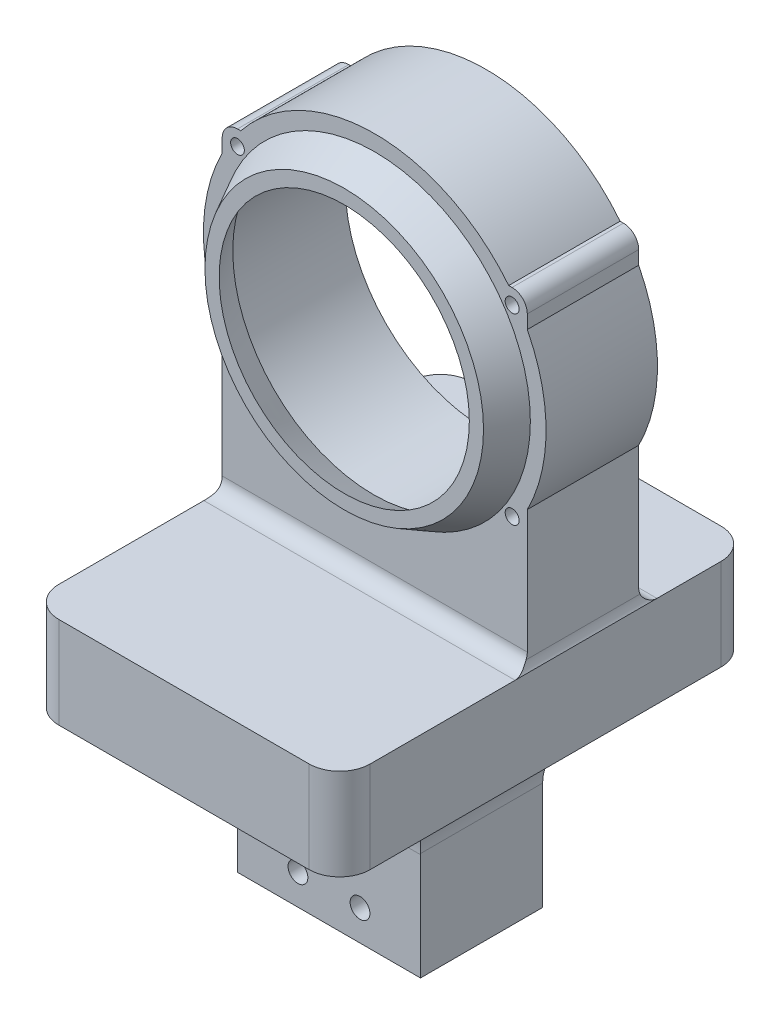
from build123d import *
from OCP.BRepAlgoAPI import BRepAlgoAPI_Cut
from OCP.TopTools import TopTools_ListOfShape

# Parameters (mm, degrees)
CROQUIS1_W              = 102
CROQUIS1_H              = 135
SALIENTE_EXTRUIR1_DEPTH = 30
SALIENTE_EXTRUIR2_START = 5
CROQUIS3_R              = 46.15
SALIENTE_EXTRUIR2_DEPTH = 36.5
CROQUIS5_R              = 51
CROQUIS5_R_2            = 41
SALIENTE_EXTRUIR3_DEPTH = 10
CHAFL_N1_SIZE           = 5.350722602
CHAFL_N1_SIZE_2         = 10
CHAFL_N2_SIZE2          = 5.350722602
CHAFL_N2_SIZE           = 10
REDONDEO1_R             = 5
CROQUIS7_R              = 2.248271999
CROQUIS7_R_2            = 2.283107554
CORTAR_EXTRUIR2_DEPTH   = 195.035937393
REDONDEO2_R             = 10
CROQUIS8_W              = 60
CROQUIS8_H              = 40
CROQUIS8_W_2            = 40
CROQUIS8_H_2            = 20
SALIENTE_EXTRUIR4_DEPTH = 60
REDONDEO3_START         = -20
REDONDEO3_DEPTH         = 40
REDONDEO3_START_2       = -51.000005347
REDONDEO3_2_DEPTH       = 102.000005347
REDONDEO3_START_3       = -57.5
REDONDEO3_3_DEPTH       = 115
CROQUIS9_R              = 3.25
CORTAR_EXTRUIR3_DEPTH   = 189.428222408


with BuildPart() as part:
    # Croquis1 → Saliente-Extruir1 (new body)
    with BuildSketch(Plane(origin=(0, 0, 0), x_dir=(1, 0, 0), z_dir=(0, 1, 0))):
        Rectangle(CROQUIS1_W, CROQUIS1_H)
    extrude(amount=SALIENTE_EXTRUIR1_DEPTH)

    # Croquis3 → Saliente-Extruir2 (add)
    with BuildSketch(Plane.XY.offset(SALIENTE_EXTRUIR2_START)):
        with BuildLine():
            Line((45, 136), (43.906975528, 136))
            ThreePointArc((43.906975528, 136), (0, 157.15), (-43.906975528, 136))
            Line((-43.906975528, 136), (-45, 136))
            ThreePointArc((-45, 136), (-48.535533906, 134.535533906), (-50, 131))
            Line((-50, 131), (-50, 126.550391386))
            ThreePointArc((-50, 126.550391386), (-56.15, 101), (-50, 75.449608614))
            Line((-50, 75.449608614), (-50, 30))
            Line((-50, 30), (50, 30))
            Line((50, 30), (50, 75.449608614))
            ThreePointArc((50, 75.449608614), (56.15, 101), (50, 126.550391386))
            Line((50, 126.550391386), (50, 131))
            ThreePointArc((50, 131), (48.535533906, 134.535533906), (45, 136))
        make_face()
        with Locations((0, 101)):
            Circle(CROQUIS3_R, mode=Mode.SUBTRACT)
    extrude(amount=-SALIENTE_EXTRUIR2_DEPTH)

    # Croquis5 → Saliente-Extruir3 (add)
    with BuildSketch(Plane.XY.offset(5)):
        with Locations((0, 101)):
            Circle(CROQUIS5_R)
        with Locations((0, 101)):
            Circle(CROQUIS5_R_2, mode=Mode.SUBTRACT)
    extrude(amount=SALIENTE_EXTRUIR3_DEPTH)

    # Chaflán1
    # the kernel refuses this chamfer: 10, 5.350722602 mm, written as the material it takes off along each edge
    with BuildSketch(Plane(origin=(0, 101, 5), x_dir=(1, 0, 0), z_dir=(0, -1, 0))) as chafl_n1_piece_1_section:
        Polygon((41 + CHAFL_N1_SIZE, 0), (41, CHAFL_N1_SIZE_2), (41, 0), align=None)
    chafl_n1_piece_1 = revolve(axis=Axis((0, 101, 5), (0, 0, 1)), mode=Mode.PRIVATE)
    chafl_n1_piece_1 = chafl_n1_piece_1 & Plane(origin=(0, 101, 5), x_dir=(1, 0, 0), z_dir=(0, 0, 1)) * Cylinder(46.15, 186, mode=Mode.PRIVATE)
    add(chafl_n1_piece_1, mode=Mode.SUBTRACT)

    # Chaflán2
    chafl_n2_edges = [part.edges().sort_by_distance(p)[0] for p in [
        (-51, 101, 15),
    ]]
    chafl_n2_side = [part.faces().sort_by_distance(p)[0] for p in [
        (-51, 101, 14.892985548),
    ]]
    chamfer(chafl_n2_edges, length=CHAFL_N2_SIZE - 0.0001, length2=CHAFL_N2_SIZE2 - 0.0001, reference=chafl_n2_side[0])  # a hair under: the kernel refuses the full size

    # Redondeo1
    # the kernel refuses this fillet: 5 mm, written as the material it adds along each edge
    with BuildSketch(Plane(origin=(-50, 30, -31.5), x_dir=(0, 0, -1), z_dir=(1, 0, 0)), Plane(origin=(-50, 30, 5), x_dir=(0, 1, 0), z_dir=(1, 0, 0))) as redondeo1_piece_1:
        with BuildLine():
            CenterArc((REDONDEO1_R, REDONDEO1_R), REDONDEO1_R, 180, 90)
            Line((0, REDONDEO1_R), (-REDONDEO1_R * 0.02, REDONDEO1_R))
            Line((-REDONDEO1_R * 0.02, REDONDEO1_R), (-REDONDEO1_R * 0.02, -REDONDEO1_R * 0.02))
            Line((-REDONDEO1_R * 0.02, -REDONDEO1_R * 0.02), (REDONDEO1_R, -REDONDEO1_R * 0.02))
            Line((REDONDEO1_R, -REDONDEO1_R * 0.02), (REDONDEO1_R, 0))
        make_face()
    extrude(amount=100)
    with BuildSketch(Plane(origin=(50, 30, 5), x_dir=(0, 1, 0), z_dir=(0, 0, -1))) as redondeo1_piece_2:
        with BuildLine():
            CenterArc((3, 5), REDONDEO1_R, 233.130102354, 36.869897646)
            Line((0, 1), (-0.06, 0.92))
            ThreePointArc((-0.06, 0.92), (-0.1, 0.5), (-0.1, 0))
            Line((-0.1, 0), (0, -0.1))
            Line((0, -0.1), (3, -0.1))
            Line((3, -0.1), (3, 0))
        make_face()
    extrude(amount=36.5)
    with BuildSketch(Plane(origin=(-50, 30, 5), x_dir=(-1, 0, 0), z_dir=(0, 0, -1))) as redondeo1_piece_3:
        with BuildLine():
            CenterArc((5, 3), REDONDEO1_R, 180, 36.869897646)
            Line((0, 3), (-0.1, 3))
            Line((-0.1, 3), (-0.1, 0))
            Line((-0.1, 0), (0, -0.1))
            ThreePointArc((0, -0.1), (0.5, -0.1), (0.92, -0.06))
            Line((0.92, -0.06), (1, 0))
        make_face()
    extrude(amount=36.5)
    with BuildSketch(Plane(origin=(-50, 30, 5), x_dir=(-1, 0, 0), z_dir=(0, 0, -1))) as redondeo1_piece_4a_section:
        with BuildLine():
            CenterArc((5, 3), REDONDEO1_R, 180, 36.869897646)
            Line((0, 3), (-0.1, 3))
            Line((-0.1, 3), (-0.1, 0))
            Line((-0.1, 0), (0, -0.1))
            ThreePointArc((0, -0.1), (0.5, -0.1), (0.92, -0.06))
            Line((0.92, -0.06), (1, 0))
        make_face()
    redondeo1_piece_4a = extrude(amount=44, mode=Mode.PRIVATE)
    redondeo1_piece_4a = split(redondeo1_piece_4a, bisect_by=Plane(origin=(-50, 30, -31.5), z_dir=(0, 0, -1)), keep=Keep.TOP, mode=Mode.PRIVATE)
    with BuildSketch(Plane(origin=(-62.5, 30, -31.5), x_dir=(0, 0, -1), z_dir=(1, 0, 0))) as redondeo1_piece_4b_section:
        with BuildLine():
            CenterArc((REDONDEO1_R, REDONDEO1_R), REDONDEO1_R, 180, 90)
            Line((0, REDONDEO1_R), (-REDONDEO1_R * 0.02, REDONDEO1_R))
            Line((-REDONDEO1_R * 0.02, REDONDEO1_R), (-REDONDEO1_R * 0.02, -REDONDEO1_R * 0.02))
            Line((-REDONDEO1_R * 0.02, -REDONDEO1_R * 0.02), (REDONDEO1_R, -REDONDEO1_R * 0.02))
            Line((REDONDEO1_R, -REDONDEO1_R * 0.02), (REDONDEO1_R, 0))
        make_face()
    redondeo1_piece_4b = extrude(amount=112.5, mode=Mode.PRIVATE)
    redondeo1_piece_4b = split(redondeo1_piece_4b, bisect_by=Plane(origin=(-51, 30, -31.5), z_dir=(1, 0, 0)), keep=Keep.TOP, mode=Mode.PRIVATE)
    redondeo1_piece_4b = split(redondeo1_piece_4b, bisect_by=Plane(origin=(-50, 30, -31.5), z_dir=(-1, 0, 0)), keep=Keep.TOP, mode=Mode.PRIVATE)
    redondeo1_piece_4 = redondeo1_piece_4a & redondeo1_piece_4b
    add(redondeo1_piece_4)
    with BuildSketch(Plane(origin=(50, 30, 5), x_dir=(0, 1, 0), z_dir=(0, 0, -1))) as redondeo1_piece_5a_section:
        with BuildLine():
            CenterArc((3, 5), REDONDEO1_R, 233.130102354, 36.869897646)
            Line((0, 1), (-0.06, 0.92))
            ThreePointArc((-0.06, 0.92), (-0.1, 0.5), (-0.1, 0))
            Line((-0.1, 0), (0, -0.1))
            Line((0, -0.1), (3, -0.1))
            Line((3, -0.1), (3, 0))
        make_face()
    redondeo1_piece_5a = extrude(amount=44, mode=Mode.PRIVATE)
    redondeo1_piece_5a = split(redondeo1_piece_5a, bisect_by=Plane(origin=(50, 30, -31.5), z_dir=(0, 0, -1)), keep=Keep.TOP, mode=Mode.PRIVATE)
    with BuildSketch(Plane(origin=(-50, 30, -31.5), x_dir=(0, 0, -1), z_dir=(1, 0, 0))) as redondeo1_piece_5b_section:
        with BuildLine():
            CenterArc((REDONDEO1_R, REDONDEO1_R), REDONDEO1_R, 180, 90)
            Line((0, REDONDEO1_R), (-REDONDEO1_R * 0.02, REDONDEO1_R))
            Line((-REDONDEO1_R * 0.02, REDONDEO1_R), (-REDONDEO1_R * 0.02, -REDONDEO1_R * 0.02))
            Line((-REDONDEO1_R * 0.02, -REDONDEO1_R * 0.02), (REDONDEO1_R, -REDONDEO1_R * 0.02))
            Line((REDONDEO1_R, -REDONDEO1_R * 0.02), (REDONDEO1_R, 0))
        make_face()
    redondeo1_piece_5b = extrude(amount=112.5, mode=Mode.PRIVATE)
    redondeo1_piece_5b = split(redondeo1_piece_5b, bisect_by=Plane(origin=(50, 30, -31.5), z_dir=(1, 0, 0)), keep=Keep.TOP, mode=Mode.PRIVATE)
    redondeo1_piece_5b = split(redondeo1_piece_5b, bisect_by=Plane(origin=(51, 30, -31.5), z_dir=(-1, 0, 0)), keep=Keep.TOP, mode=Mode.PRIVATE)
    redondeo1_piece_5 = redondeo1_piece_5a & redondeo1_piece_5b
    add(redondeo1_piece_5)
    with BuildSketch(Plane(origin=(-50, 30, 5), x_dir=(0, 1, 0), z_dir=(1, 0, 0))) as redondeo1_piece_6a_section:
        with BuildLine():
            CenterArc((REDONDEO1_R, REDONDEO1_R), REDONDEO1_R, 180, 90)
            Line((0, REDONDEO1_R), (-REDONDEO1_R * 0.02, REDONDEO1_R))
            Line((-REDONDEO1_R * 0.02, REDONDEO1_R), (-REDONDEO1_R * 0.02, -REDONDEO1_R * 0.02))
            Line((-REDONDEO1_R * 0.02, -REDONDEO1_R * 0.02), (REDONDEO1_R, -REDONDEO1_R * 0.02))
            Line((REDONDEO1_R, -REDONDEO1_R * 0.02), (REDONDEO1_R, 0))
        make_face()
    redondeo1_piece_6a = extrude(amount=112.5, mode=Mode.PRIVATE)
    redondeo1_piece_6a = split(redondeo1_piece_6a, bisect_by=Plane(origin=(50, 30, 5), z_dir=(1, 0, 0)), keep=Keep.TOP, mode=Mode.PRIVATE)
    redondeo1_piece_6a = split(redondeo1_piece_6a, bisect_by=Plane(origin=(51, 30, 5), z_dir=(-1, 0, 0)), keep=Keep.TOP, mode=Mode.PRIVATE)
    with BuildSketch(Plane(origin=(50, 30, 12.5), x_dir=(0, 1, 0), z_dir=(0, 0, -1))) as redondeo1_piece_6b_section:
        with BuildLine():
            CenterArc((3, 5), REDONDEO1_R, 233.130102354, 36.869897646)
            Line((0, 1), (-0.06, 0.92))
            ThreePointArc((-0.06, 0.92), (-0.1, 0.5), (-0.1, 0))
            Line((-0.1, 0), (0, -0.1))
            Line((0, -0.1), (3, -0.1))
            Line((3, -0.1), (3, 0))
        make_face()
    redondeo1_piece_6b = extrude(amount=44, mode=Mode.PRIVATE)
    redondeo1_piece_6b = split(redondeo1_piece_6b, bisect_by=Plane(origin=(50, 30, 5), z_dir=(0, 0, 1)), keep=Keep.TOP, mode=Mode.PRIVATE)
    redondeo1_piece_6 = redondeo1_piece_6a & redondeo1_piece_6b
    add(redondeo1_piece_6)
    with BuildSketch(Plane(origin=(-62.5, 30, 5), x_dir=(0, 1, 0), z_dir=(1, 0, 0))) as redondeo1_piece_7a_section:
        with BuildLine():
            CenterArc((REDONDEO1_R, REDONDEO1_R), REDONDEO1_R, 180, 90)
            Line((0, REDONDEO1_R), (-REDONDEO1_R * 0.02, REDONDEO1_R))
            Line((-REDONDEO1_R * 0.02, REDONDEO1_R), (-REDONDEO1_R * 0.02, -REDONDEO1_R * 0.02))
            Line((-REDONDEO1_R * 0.02, -REDONDEO1_R * 0.02), (REDONDEO1_R, -REDONDEO1_R * 0.02))
            Line((REDONDEO1_R, -REDONDEO1_R * 0.02), (REDONDEO1_R, 0))
        make_face()
    redondeo1_piece_7a = extrude(amount=112.5, mode=Mode.PRIVATE)
    redondeo1_piece_7a = split(redondeo1_piece_7a, bisect_by=Plane(origin=(-50, 30, 5), z_dir=(-1, 0, 0)), keep=Keep.TOP, mode=Mode.PRIVATE)
    redondeo1_piece_7a = split(redondeo1_piece_7a, bisect_by=Plane(origin=(-51, 30, 5), z_dir=(1, 0, 0)), keep=Keep.TOP, mode=Mode.PRIVATE)
    with BuildSketch(Plane(origin=(-50, 30, 12.5), x_dir=(-1, 0, 0), z_dir=(0, 0, -1))) as redondeo1_piece_7b_section:
        with BuildLine():
            CenterArc((5, 3), REDONDEO1_R, 180, 36.869897646)
            Line((0, 3), (-0.1, 3))
            Line((-0.1, 3), (-0.1, 0))
            Line((-0.1, 0), (0, -0.1))
            ThreePointArc((0, -0.1), (0.5, -0.1), (0.92, -0.06))
            Line((0.92, -0.06), (1, 0))
        make_face()
    redondeo1_piece_7b = extrude(amount=44, mode=Mode.PRIVATE)
    redondeo1_piece_7b = split(redondeo1_piece_7b, bisect_by=Plane(origin=(-50, 30, 5), z_dir=(0, 0, 1)), keep=Keep.TOP, mode=Mode.PRIVATE)
    redondeo1_piece_7 = redondeo1_piece_7a & redondeo1_piece_7b
    add(redondeo1_piece_7)

    # Croquis7 → Cortar-Extruir2 (cut, through all)
    with BuildSketch(Plane(origin=(0, 0, -31.5), x_dir=(-1, 0, 0), z_dir=(0, 0, -1))):
        with Locations((44.988168305, 131.013566522)):
            Circle(CROQUIS7_R)
        with Locations((-45.026191842, 131.013566522)):
            Circle(CROQUIS7_R_2)
        with Locations(Location((-45.026191842, 70.986433478, 0), (0, 0, 180))):
            Circle(CROQUIS7_R_2)
        with Locations(Location((44.988168305, 70.986433478, 0), (0, 0, 180))):
            Circle(CROQUIS7_R)
    extrude(amount=-CORTAR_EXTRUIR2_DEPTH, mode=Mode.SUBTRACT)

    # Redondeo2
    redondeo2_edges = [part.edges().sort_by_distance(p)[0] for p in [
        (51, 15, 67.5),
        (-51, 15, 67.5),
        (-51, 15, -67.5),
        (51, 15, -67.5),
    ]]
    fillet(redondeo2_edges, radius=REDONDEO2_R)

    # Croquis8 → Saliente-Extruir4 (add)
    with BuildSketch(Plane.XZ):
        Rectangle(CROQUIS8_W, CROQUIS8_H)
        Rectangle(CROQUIS8_W_2, CROQUIS8_H_2, mode=Mode.SUBTRACT)
    extrude(amount=SALIENTE_EXTRUIR4_DEPTH)


with BuildPart() as redondeo3_tool:
    # Redondeo3: read off the stored shape, not the designer's step
    # Redondeo3 outline → Redondeo3 (new body)
    with BuildSketch(Plane.XY.offset(REDONDEO3_START)):
        with BuildLine():
            Line((-30, -24.677925359), (-30, 0))
            Line((-30, 0), (-51, 0))
            ThreePointArc((-51, 0), (-35.960567235, -8.476073612), (-30, -24.677925359))
        make_face()
        with BuildLine():
            ThreePointArc((30, -24.677925359), (35.960567235, -8.476073612), (51, 0))
            Line((51, 0), (30, 0))
            Line((30, 0), (30, -24.677925359))
        make_face()
    extrude(amount=REDONDEO3_DEPTH)


with BuildPart() as part_1:
    add(part.part)


with BuildPart() as part_2:
    # Redondeo3: joined with redondeo3_tool
    add(part_1.part.fuse(redondeo3_tool.part, tol=0.00001))


with BuildPart() as redondeo3_2_tool:
    # Redondeo3 2 outline → Redondeo3 2 (new body)
    with BuildSketch(Plane.YZ.offset(REDONDEO3_START_2)):
        with BuildLine():
            ThreePointArc((0, 45), (-7.32233047, 27.32233047), (-25, 20))
            Line((-25, 20), (0, 20))
            Line((0, 20), (0, 45))
        make_face()
        with BuildLine():
            Line((0, -20), (-25, -20))
            ThreePointArc((-25, -20), (-7.32233047, -27.32233047), (0, -45))
            Line((0, -45), (0, -20))
        make_face()
    extrude(amount=REDONDEO3_2_DEPTH)


with BuildPart() as part_3:
    add(part_2.part)


with BuildPart() as part_4:
    # Redondeo3 2: joined with redondeo3_2_tool
    add(part_3.part.fuse(redondeo3_2_tool.part, tol=0.00001))


with BuildPart() as redondeo3_3_tool:
    # Redondeo3 3 outline → Redondeo3 3 (new body)
    with BuildSketch(Plane.XY.offset(REDONDEO3_START_3)):
        with BuildLine():
            ThreePointArc((-30, -24.677925359), (-35.960567235, -8.476073612), (-51, 0))
            Line((-51, 0), (-51.000005347, -25))
            Line((-51.000005347, -25), (-30, -25))
            Line((-30, -25), (-30, -24.677925359))
        make_face()
        with BuildLine():
            Line((51, -25), (51, 0))
            ThreePointArc((51, 0), (35.960567235, -8.476073612), (30, -24.677925359))
            Line((30, -24.677925359), (30, -25))
            Line((30, -25), (51, -25))
        make_face()
    extrude(amount=REDONDEO3_3_DEPTH)


with BuildPart() as part_5:
    add(part_4.part)

    # Redondeo3 3: cut by redondeo3_3_tool, with a tolerance
    redondeo3_3_stock = TopTools_ListOfShape()
    redondeo3_3_stock.Append(part_5.part.wrapped)
    redondeo3_3_tools = TopTools_ListOfShape()
    redondeo3_3_tools.Append(redondeo3_3_tool.part.wrapped)
    redondeo3_3_cut = BRepAlgoAPI_Cut()
    redondeo3_3_cut.SetArguments(redondeo3_3_stock)
    redondeo3_3_cut.SetTools(redondeo3_3_tools)
    redondeo3_3_cut.SetFuzzyValue(0.00001)
    redondeo3_3_cut.Build()
    add(Compound.cast(redondeo3_3_cut.Shape()).solids(), mode=Mode.REPLACE)

    # Croquis9 → Cortar-Extruir3 (cut, through all)
    with BuildSketch(Plane(origin=(0, 0, -20), x_dir=(-1, 0, 0), z_dir=(0, 0, -1))):
        with Locations((-10.17, -50)):
            Circle(CROQUIS9_R)
        with Locations(Location((10.17, -50, 0), (0, 0, 180))):
            Circle(CROQUIS9_R)
        with Locations((10.17, -35)):
            Circle(CROQUIS9_R)
        with Locations(Location((-10.17, -35, 0), (0, 0, 180))):
            Circle(CROQUIS9_R)
    extrude(amount=-CORTAR_EXTRUIR3_DEPTH, mode=Mode.SUBTRACT)


solid = part_5.part
